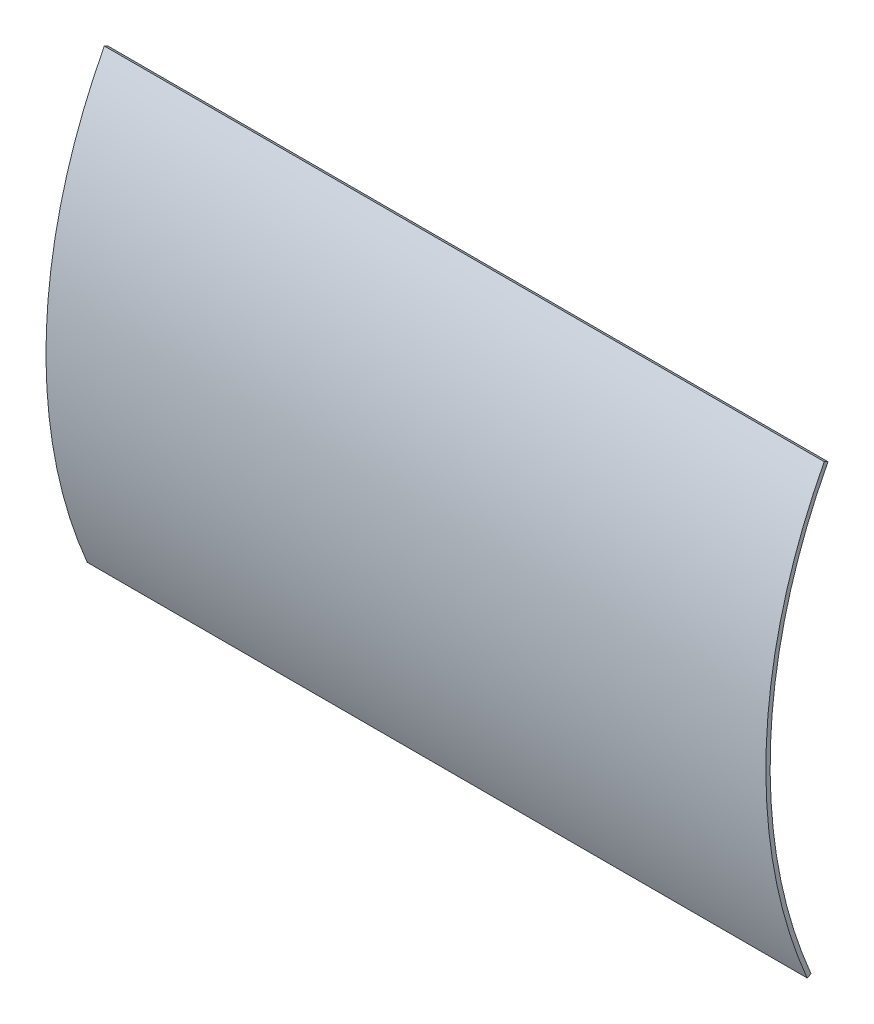
from build123d import *

# Parameters (mm, degrees)
BASE_FLANGE1_DEPTH      = 123.698
BASE_FLANGE1_DEPTH_BACK = 1.27


# Sheet-metal steps are written as plain solids
with BuildPart() as part:
    # Sketch2 → Base-Flange1 (new, two sides: drawn at the far end of the back side and taken through both)
    with BuildSketch(Plane(origin=(0, 0, 0), x_dir=(0, 0, -1), z_dir=(1, 0, 0)).offset(-BASE_FLANGE1_DEPTH_BACK)):
        with BuildLine():
            ThreePointArc((0, 0), (-7.101349637, 38.407856923), (2.958975316, 76.148849252))
            Line((2.958975316, 76.148849252), (3.611595566, 75.807284661))
            ThreePointArc((3.611595566, 75.807284661), (-6.365305114, 38.379255866), (0.677157267, 0.289892387))
            Line((0.677157267, 0.289892387), (0, 0))
        make_face()
    extrude(amount=BASE_FLANGE1_DEPTH + BASE_FLANGE1_DEPTH_BACK)


solid = part.part
